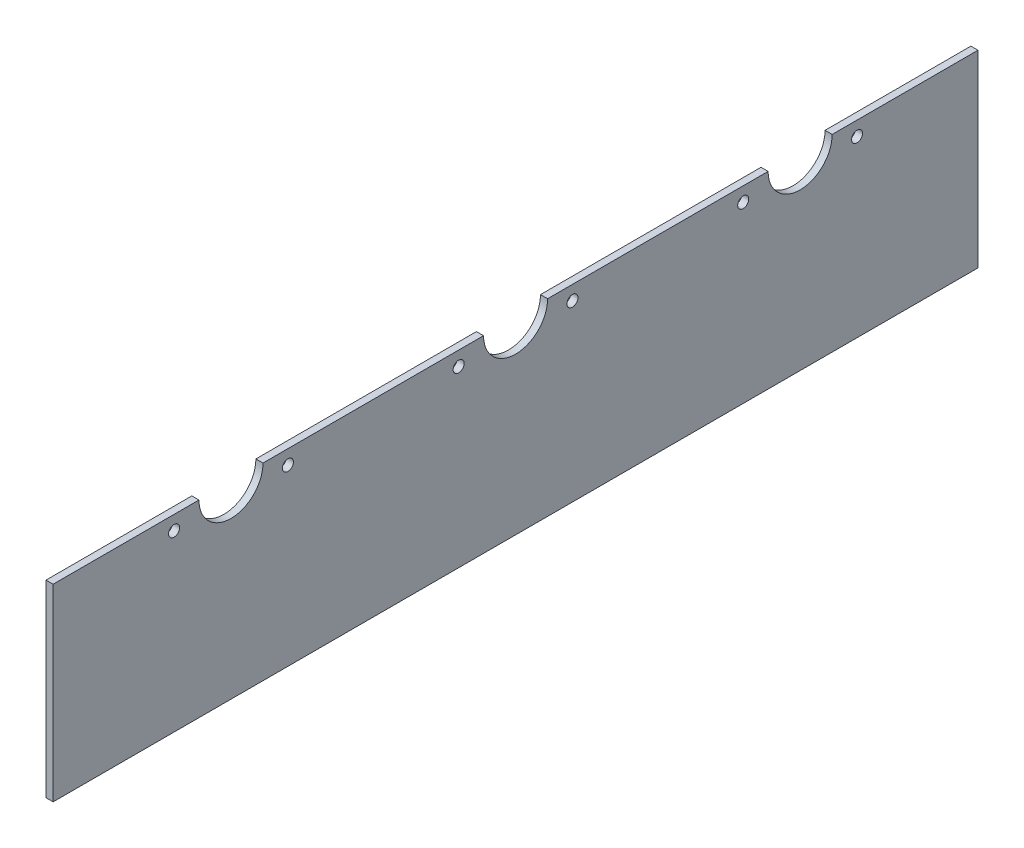
from build123d import *

# Parameters (mm, degrees)
BOSS_EXTRUDE1_DEPTH          = 3.175
F_10_0_1935_DIAMETER_HOLE1_D = 4.9149


with BuildPart() as part:
    # Sketch1 → Boss-Extrude1 (new body)
    with BuildSketch(Plane(origin=(0, 0, 0), x_dir=(0, 0, -1), z_dir=(1, 0, 0))):
        with BuildLine():
            Line((206.375, 0), (-206.375, 0))
            Line((-206.375, 0), (-206.375, 84.1375))
            Line((-206.375, 84.1375), (-141.2875, 84.1375))
            ThreePointArc((-141.2875, 84.1375), (-127, 69.85), (-112.7125, 84.1375))
            Line((-112.7125, 84.1375), (-14.2875, 84.1375))
            ThreePointArc((-14.2875, 84.1375), (0, 69.85), (14.2875, 84.1375))
            Line((14.2875, 84.1375), (112.7125, 84.1375))
            ThreePointArc((112.7125, 84.1375), (127, 69.85), (141.2875, 84.1375))
            Line((141.2875, 84.1375), (206.375, 84.1375))
            Line((206.375, 84.1375), (206.375, 0))
        make_face()
    extrude(amount=BOSS_EXTRUDE1_DEPTH)

    # #10 (0.1935) Diameter Hole1 (through all)
    with Locations(Plane(origin=(3.175, 0, 0), x_dir=(0, 0, -1), z_dir=(1, 0, 0))):
        with Locations((-152.4, 77.7875), (-101.6, 77.7875), (-25.4, 77.7875), (25.4, 77.7875), (101.6, 77.7875), (152.4, 77.7875)):
            Hole(F_10_0_1935_DIAMETER_HOLE1_D / 2)


solid = part.part
